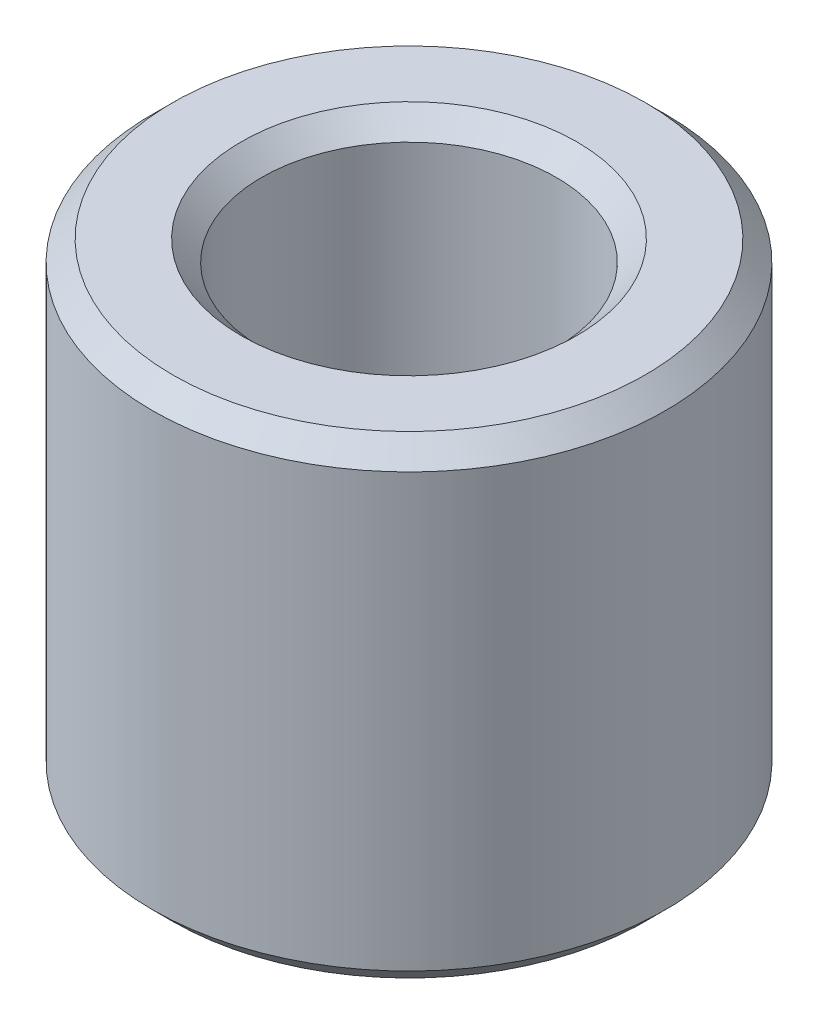
from build123d import *

# Parameters (mm, degrees)
SKETCH1_R           = 47.5
BOSS_EXTRUDE1_DEPTH = 87.603639304
SKETCH2_R           = 27.275470161
CUT_EXTRUDE1_DEPTH  = 111.394282548
CHAMFER1_SIZE       = 3.7992213


with BuildPart() as part:
    # Sketch1 → Boss-Extrude1 (new body)
    with BuildSketch(Plane(origin=(0, 0, 0), x_dir=(1, 0, 0), z_dir=(0, 1, 0))):
        Circle(SKETCH1_R)
    extrude(amount=BOSS_EXTRUDE1_DEPTH)

    # Sketch2 → Cut-Extrude1 (cut, through all)
    with BuildSketch(Plane(origin=(0, 0, 0), x_dir=(1, 0, 0), z_dir=(0, 1, 0))):
        Circle(SKETCH2_R)
    extrude(amount=CUT_EXTRUDE1_DEPTH, mode=Mode.SUBTRACT)

    # Chamfer1
    chamfer1_edges = [part.edges().sort_by_distance(p)[0] for p in [
        (-27.275470161, 87.603639304, 0),
        (-27.275470161, 0, 0),
        (-47.5, 0, 0),
        (-47.5, 87.603639304, 0),
    ]]
    chamfer(chamfer1_edges, length=CHAMFER1_SIZE)


solid = part.part
